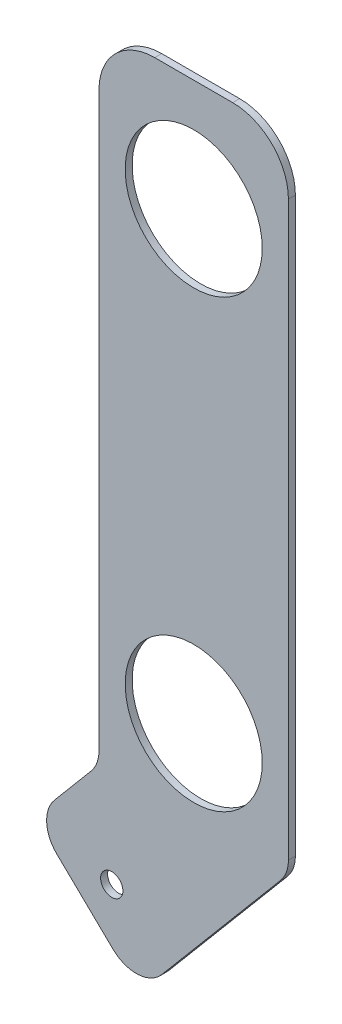
from build123d import *

# Parameters (mm, degrees)
SKETCH1_R           = 15.621
SKETCH1_R_2         = 2.54
BOSS_EXTRUDE1_DEPTH = 1.5875


with BuildPart() as part:
    # Sketch1 → Boss-Extrude1 (new body)
    with BuildSketch(Plane.XY):
        with BuildLine():
            Line((-8.89, 25.4), (8.89, 25.4))
            ThreePointArc((8.89, 25.4), (17.870256121, 21.680256121), (21.59, 12.7))
            Line((21.59, 12.7), (21.59, -117.775079775))
            ThreePointArc((21.59, -117.775079775), (21.127743647, -120.388718212), (19.797058824, -122.685251408))
            Line((19.797058824, -122.685251408), (-7.265245808, -154.800959935))
            ThreePointArc((-7.265245808, -154.800959935), (-12.702595742, -157.500816356), (-18.387297428, -155.370519251))
            Line((-18.387297428, -155.370519251), (-31.202992042, -142.986880112))
            ThreePointArc((-31.202992042, -142.986880112), (-33.518027299, -137.896858051), (-31.735058069, -132.596977529))
            Line((-31.735058069, -132.596977529), (-23.382941176, -122.685251408))
            ThreePointArc((-23.382941176, -122.685251408), (-22.052256353, -120.388718212), (-21.59, -117.775079775))
            Line((-21.59, -117.775079775), (-21.59, 12.7))
            ThreePointArc((-21.59, 12.7), (-17.870256121, 21.680256121), (-8.89, 25.4))
        make_face()
        Circle(SKETCH1_R, mode=Mode.SUBTRACT)
        with Locations((0, -101.6)):
            Circle(SKETCH1_R, mode=Mode.SUBTRACT)
        with Locations((-18.679891904, -142.72553973)):
            Circle(SKETCH1_R_2, mode=Mode.SUBTRACT)
    extrude(amount=BOSS_EXTRUDE1_DEPTH)


solid = part.part
